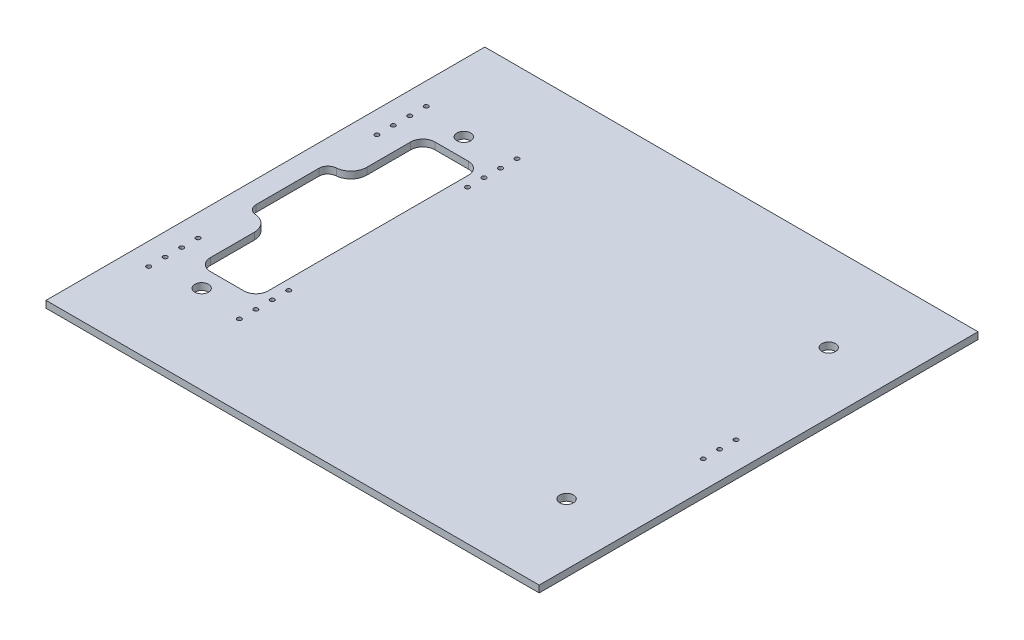
from build123d import *

# Parameters (mm, degrees)
SKETCH1_W           = 114.194238105
SKETCH1_H           = 101.6
BOSS_EXTRUDE1_DEPTH = 1.5875
SKETCH2_R           = 0.5
SKETCH2_R_2         = 1.5875
CUT_EXTRUDE1_DEPTH  = 77.980284056
CUT_EXTRUDE2_DEPTH  = 77.980284056


with BuildPart() as part:
    # Sketch1 → Boss-Extrude1 (new body)
    with BuildSketch(Plane(origin=(0, 0, 0), x_dir=(1, 0, 0), z_dir=(0, 1, 0))):
        with Locations((0.719867873, 0)):
            Rectangle(SKETCH1_W, SKETCH1_H)
    extrude(amount=-BOSS_EXTRUDE1_DEPTH)

    # Sketch2 → Cut-Extrude1 (cut, through all)
    with BuildSketch(Plane(origin=(0, 0, 0), x_dir=(1, 0, 0), z_dir=(0, 1, 0))):
        with Locations((-51.27045, 24.505)):
            Circle(SKETCH2_R)
        with Locations((-30.27045, 28.315)):
            Circle(SKETCH2_R)
        with Locations((-30.27045, 32.125)):
            Circle(SKETCH2_R)
        with Locations((-30.27045, -32.135)):
            Circle(SKETCH2_R)
        with Locations((-30.27045, -28.325)):
            Circle(SKETCH2_R)
        with Locations((-30.27045, -24.515)):
            Circle(SKETCH2_R)
        with Locations((-30.27045, -20.705)):
            Circle(SKETCH2_R)
        with Locations((51.47945, -6.483)):
            Circle(SKETCH2_R)
        with Locations((51.47945, -2.673)):
            Circle(SKETCH2_R)
        with Locations((-51.27045, 28.315)):
            Circle(SKETCH2_R)
        with Locations((-51.27045, 32.125)):
            Circle(SKETCH2_R)
        with Locations((-51.27045, -32.135)):
            Circle(SKETCH2_R)
        with Locations((-51.27045, -28.325)):
            Circle(SKETCH2_R)
        with Locations((-51.27045, -24.515)):
            Circle(SKETCH2_R)
        with Locations((-51.27045, -20.705)):
            Circle(SKETCH2_R)
        with Locations((-30.27045, 20.695)):
            Circle(SKETCH2_R)
        with Locations((-30.27045, 24.505)):
            Circle(SKETCH2_R)
        with Locations((-40.78945, -30.35)):
            Circle(SKETCH2_R_2)
        with Locations((-40.78945, 30.35)):
            Circle(SKETCH2_R_2)
        with Locations((43.71055, 30.35)):
            Circle(SKETCH2_R_2)
        with Locations((43.71055, -30.35)):
            Circle(SKETCH2_R_2)
        with Locations((51.47945, 1.137)):
            Circle(SKETCH2_R)
        with Locations((-51.27045, 20.695)):
            Circle(SKETCH2_R)
    extrude(amount=-CUT_EXTRUDE1_DEPTH, mode=Mode.SUBTRACT)

    # Sketch3 → Cut-Extrude2 (cut, through all)
    with BuildSketch(Plane(origin=(0, 0, 0), x_dir=(1, 0, 0), z_dir=(0, 1, 0))):
        with BuildLine():
            Line((-51.262656439, -7.304189341), (-51.262656439, 7.304189341))
            ThreePointArc((-51.262656439, 7.304189341), (-50.671066051, 8.732414877), (-49.242840515, 9.324005264))
            Line((-49.242840515, 9.324005264), (-49.614809023, 9.324005264))
            ThreePointArc((-49.614809023, 9.324005264), (-47.00154916, 10.406452941), (-45.919101483, 13.019712803))
            Line((-45.919101483, 13.019712803), (-45.919101483, 23.19478635))
            ThreePointArc((-45.919101483, 23.19478635), (-45.099361632, 25.173813417), (-43.120334565, 25.993553268))
            Line((-43.120334565, 25.993553268), (-35.358981014, 25.993553268))
            ThreePointArc((-35.358981014, 25.993553268), (-33.379953947, 25.173813417), (-32.560214095, 23.19478635))
            Line((-32.560214095, 23.19478635), (-32.560214095, -23.19478635))
            ThreePointArc((-32.560214095, -23.19478635), (-33.379953947, -25.173813417), (-35.358981014, -25.993553268))
            Line((-35.358981014, -25.993553268), (-43.120334565, -25.993553268))
            ThreePointArc((-43.120334565, -25.993553268), (-45.099361632, -25.173813417), (-45.919101483, -23.19478635))
            Line((-45.919101483, -23.19478635), (-45.919101483, -13.019712803))
            ThreePointArc((-45.919101483, -13.019712803), (-47.00154916, -10.406452941), (-49.614809023, -9.324005264))
            Line((-49.614809023, -9.324005264), (-49.242840515, -9.324005264))
            ThreePointArc((-49.242840515, -9.324005264), (-50.671066051, -8.732414877), (-51.262656439, -7.304189341))
        make_face()
    extrude(amount=-CUT_EXTRUDE2_DEPTH, mode=Mode.SUBTRACT)


solid = part.part
